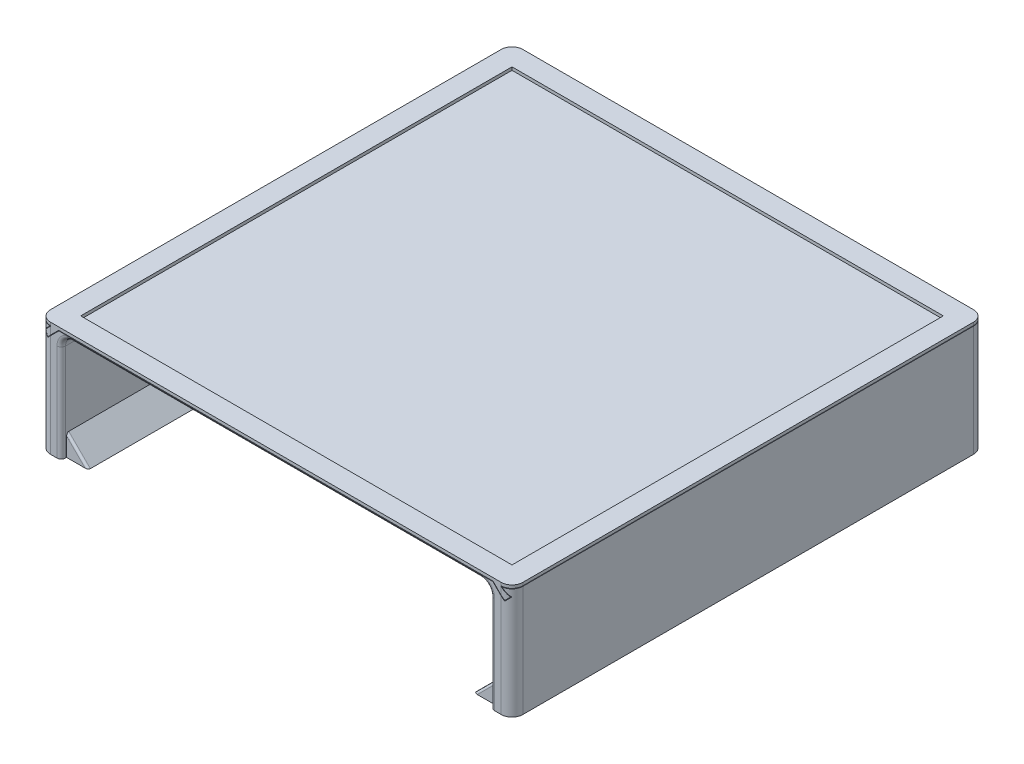
from build123d import *

# Parameters (mm, degrees)
BOSS_EXTRUDE1_DEPTH  = 109.5
BOSS_EXTRUDE2_DEPTH  = 109.5
SKETCH2_W            = 200
SKETCH2_H            = 200
CUT_EXTRUDE1_DEPTH   = 164.258659801
FILLET1_R            = 5
SKETCH3_W            = 199
SKETCH3_H            = 50
BOSS_EXTRUDE3_DEPTH  = 5
FILLET2_R            = 5
SKETCH9_W            = 379
SKETCH9_H            = 379
CUT_EXTRUDE3_DEPTH   = 164.707391403
FILLET4_R            = 2
FILLET5_R            = 1
BOSS_EXTRUDE6_DEPTH  = 107
FILLET6_R            = 1
FILLET6_OF_MIRROR1_R = 1
CUT_EXTRUDE4_DEPTH   = 2.05
LPATTERN1_COUNT      = 2
LPATTERN1_PITCH      = 22
LPATTERN1_COL_COUNT  = 2
LPATTERN1_COL_PITCH  = 22


with BuildPart() as part:
    # Sketch1 → Boss-Extrude1 (new, symmetric)
    with BuildSketch(Plane.XY):
        Polygon((-99.5, -1.5), (99.5, -1.5), (99.5, -51.5), (109.5, -51.5), (109.5, 0), (104.717157288, 0), (108, -3.282842712), (105.949390335, -5.333452378), (100.615937957, 0), (-100.615937957, 0), (-105.949390335, -5.333452378), (-108, -3.282842712), (-104.717157288, 0), (-109.5, 0), (-109.5, -51.5), (-99.5, -51.5), align=None)
    extrude(amount=BOSS_EXTRUDE1_DEPTH, both=True)

    # Fillet1
    fillet1_edges = [part.edges().sort_by_distance(p)[0] for p in [
        (99.5, -1.5, 0),
        (-99.5, -1.5, 0),
    ]]
    fillet(fillet1_edges, radius=FILLET1_R)

    # Sketch3 → Boss-Extrude3 (add, symmetric)
    with BuildSketch(Plane.XY):
        with Locations((0, -26.5)):
            Rectangle(SKETCH3_W, SKETCH3_H)
    extrude(amount=BOSS_EXTRUDE3_DEPTH, both=True)

    # Fillet2
    fillet2_edges = [part.edges().sort_by_distance(p)[0] for p in [
        (-109.5, -25.75, 109.5),
        (-109.5, -25.75, -109.5),
        (109.5, -25.75, -109.5),
        (109.5, -25.75, 109.5),
    ]]
    fillet(fillet2_edges, radius=FILLET2_R)

    # Fillet4
    fillet4_edges = [part.edges().sort_by_distance(p)[0] for p in [
        (-99.5, -29, 109.5),
        (-98.035533906, -2.964466094, 109.5),
        (99.5, -29, 109.5),
        (98.035533906, -2.964466094, 109.5),
        (-99.5, -29, -109.5),
        (-98.035533906, -2.964466094, -109.5),
        (99.5, -29, -109.5),
        (98.035533906, -2.964466094, -109.5),
        (0, -1.5, 109.5),
        (0, -1.5, -109.5),
    ]]
    fillet(fillet4_edges, radius=FILLET4_R)

    # Fillet5
    fillet5_edges = [part.edges().sort_by_distance(p)[0] for p in [
        (-99.5, -29, -5),
        (-98.035533906, -2.964466094, -5),
        (0, -1.5, -5),
        (98.035533906, -2.964466094, -5),
        (-99.5, -29, 5),
        (-98.035533906, -2.964466094, 5),
        (0, -1.5, 5),
        (98.035533906, -2.964466094, 5),
        (99.5, -29, -5),
        (99.5, -29, 5),
    ]]
    fillet(fillet5_edges, radius=FILLET5_R)

    # Sketch6 → Boss-Extrude6 (add, symmetric)
    with BuildSketch(Plane.XY):
        Polygon((-99.5, -51.5), (-89.5, -51.5), (-99.5, -41.5), align=None)
    boss_extrude6 = extrude(amount=BOSS_EXTRUDE6_DEPTH, both=True)

    # Fillet6
    fillet6_edges = [part.edges().sort_by_distance(p)[0] for p in [
        (-94.5, -46.5, 107),
        (-94.5, -46.5, -107),
    ]]
    fillet(fillet6_edges, radius=FILLET6_R)

    # Mirror1: Boss-Extrude6 across plane
    add(boss_extrude6.mirror(Plane(origin=(0, 0, 0), x_dir=(0, 0, 1), z_dir=(1, 0, 0))))

    # Fillet6 of Mirror1
    fillet6_of_mirror1_edges = [part.edges().sort_by_distance(p)[0] for p in [
        (94.5, -46.5, 107),
        (94.5, -46.5, -107),
    ]]
    fillet(fillet6_of_mirror1_edges, radius=FILLET6_OF_MIRROR1_R)

    # Sketch10 → Cut-Extrude4 (cut, symmetric)
    with BuildSketch(Plane.XY):
        with BuildLine():
            Line((-10, -37), (10, -37))
            Line((10, -37), (10, -27))
            ThreePointArc((10, -27), (0, -17), (-10, -27))
            Line((-10, -27), (-10, -37))
        make_face()
    cut_extrude4 = extrude(amount=CUT_EXTRUDE4_DEPTH, both=True, mode=Mode.SUBTRACT)

    # LPattern1: Cut-Extrude4 ×2
    with Locations(*[(i * LPATTERN1_PITCH, 0, 0) for i in range(1, LPATTERN1_COUNT)]):
        add(cut_extrude4, mode=Mode.SUBTRACT)

    # LPattern1 col: Cut-Extrude4 ×2
    with Locations(*[(-i * LPATTERN1_COL_PITCH, 0, 0) for i in range(1, LPATTERN1_COL_COUNT)]):
        add(cut_extrude4, mode=Mode.SUBTRACT)


with BuildPart() as body_2:
    # Sketch1<4> → Boss-Extrude2 (new, symmetric)
    with BuildSketch(Plane.XY):
        Polygon((-109.5, 0.2), (-104.234314575, 0.2), (-107.717157288, -3.282842712), (-105.949390335, -5.050609665), (-100.698780669, 0.2), (100.698780669, 0.2), (105.949390335, -5.050609665), (107.717157288, -3.282842712), (104.234314575, 0.2), (109.5, 0.2), (109.5, 1.6), (-109.5, 1.6), align=None)
    extrude(amount=BOSS_EXTRUDE2_DEPTH, both=True)

    # Sketch2 → Cut-Extrude1 (cut, through all)
    with BuildSketch(Plane.XZ.offset(-0.2)):
        Rectangle(SKETCH2_W, SKETCH2_H)
    extrude(amount=-CUT_EXTRUDE1_DEPTH, mode=Mode.SUBTRACT)

    # Sketch9 → Cut-Extrude3 (cut, through all)
    with BuildSketch(Plane.XZ.offset(51.5)):
        Rectangle(SKETCH9_W, SKETCH9_H)
        with BuildLine():
            ThreePointArc((109.5, -104.5), (108.035533906, -108.035533906), (104.5, -109.5))
            Line((104.5, -109.5), (99.5, -109.5))
            Line((99.5, -109.5), (-99.5, -109.5))
            Line((-99.5, -109.5), (-104.5, -109.5))
            ThreePointArc((-104.5, -109.5), (-108.035533906, -108.035533906), (-109.5, -104.5))
            Line((-109.5, -104.5), (-109.5, 104.5))
            ThreePointArc((-109.5, 104.5), (-108.035533906, 108.035533906), (-104.5, 109.5))
            Line((-104.5, 109.5), (-99.5, 109.5))
            Line((-99.5, 109.5), (99.5, 109.5))
            Line((99.5, 109.5), (104.5, 109.5))
            ThreePointArc((104.5, 109.5), (108.035533906, 108.035533906), (109.5, 104.5))
            Line((109.5, 104.5), (109.5, -104.5))
        make_face(mode=Mode.SUBTRACT)
    extrude(amount=-CUT_EXTRUDE3_DEPTH, mode=Mode.SUBTRACT)


solid = Compound([part.part, body_2.part])
